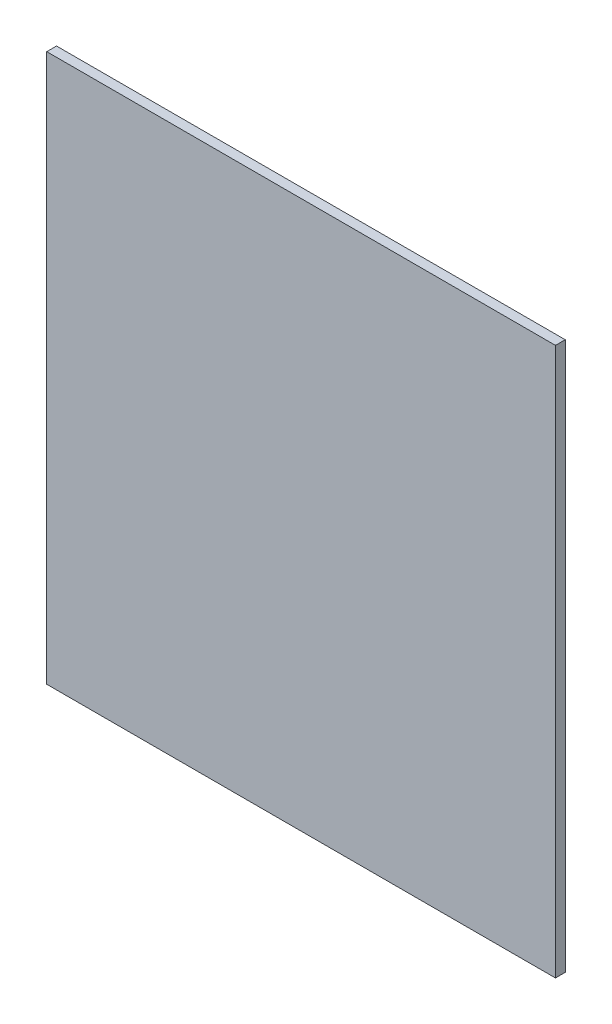
from build123d import *

# Parameters (mm, degrees)
SKETCH1_W           = 165.1
SKETCH1_H           = 177.8
BOSS_EXTRUDE1_DEPTH = 3.175


with BuildPart() as part:
    # Sketch1 → Boss-Extrude1 (new body)
    with BuildSketch(Plane.XY):
        with Locations((82.55, 88.9)):
            Rectangle(SKETCH1_W, SKETCH1_H)
    extrude(amount=-BOSS_EXTRUDE1_DEPTH)


solid = part.part
